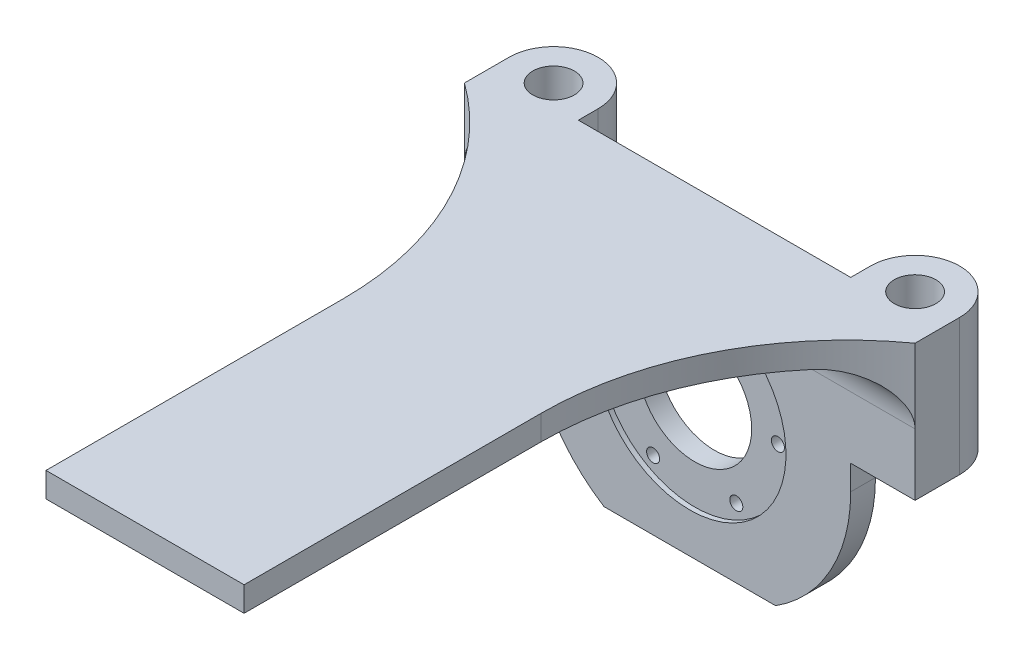
from build123d import *

# Parameters (mm, degrees)
SKETCH1_W                = 9
SKETCH1_H                = 55
SKETCH1_W_2              = 91
SKETCH1_H_2              = 5
BOSS_EXTRUDE3_DEPTH      = 5
SKETCH6_W                = 18
SKETCH6_H                = 60
BOSS_EXTRUDE4_DEPTH      = 18
SKETCH7_W                = 91
SKETCH7_H                = 5
BOSS_EXTRUDE5_DEPTH      = 100
SKETCH13_W               = 18
SKETCH13_H               = 5
CUT_EXTRUDE6_DEPTH       = 75
SKETCH16_R               = 4.2
CUT_EXTRUDE7_DEPTH       = 20
CUT_EXTRUDE8_DEPTH       = 75
CUT_EXTRUDE10_DEPTH      = 8
CUT_EXTRUDE11_DEPTH      = 22
CUT_EXTRUDE14_DEPTH      = 34
CUT_EXTRUDE14_DEPTH_BACK = 5
FILLET4_R                = 10
CUT_EXTRUDE15_DEPTH      = 24
CUT_EXTRUDE15_DEPTH_BACK = 1
SKETCH23_R               = 19.425
SKETCH24_R               = 1.315
CUT_EXTRUDE16_DEPTH      = 10
SKETCH26_W               = 40
SKETCH26_H               = 5
BOSS_EXTRUDE6_DEPTH      = 10


with BuildPart() as part:
    # Sketch1 → Boss-Extrude3 (new body)
    with BuildSketch(Plane.XY):
        with Locations((41, -0.737170899)):
            Rectangle(SKETCH1_W, SKETCH1_H)
        with Locations((32, -0.737170899)):
            Rectangle(SKETCH1_W, SKETCH1_H)
        with BuildLine():
            Line((27.5, 26.762829101), (0, 26.762829101))
            Line((0, 26.762829101), (0, 10.762829101))
            ThreePointArc((0, 10.762829101), (8.131727984, 7.394557085), (11.5, -0.737170899))
            ThreePointArc((11.5, -0.737170899), (8.131727984, -8.868898883), (0, -12.237170899))
            Line((0, -12.237170899), (0, -28.237170899))
            Line((0, -28.237170899), (27.5, -28.237170899))
            Line((27.5, -28.237170899), (27.5, 26.762829101))
        make_face()
        with BuildLine():
            Line((0, 10.762829101), (0, 26.762829101))
            Line((0, 26.762829101), (-27.5, 26.762829101))
            Line((-27.5, 26.762829101), (-27.5, -28.237170899))
            Line((-27.5, -28.237170899), (0, -28.237170899))
            Line((0, -28.237170899), (0, -12.237170899))
            ThreePointArc((0, -12.237170899), (-11.5, -0.737170899), (0, 10.762829101))
        make_face()
        with Locations((-32, -0.737170899)):
            Rectangle(SKETCH1_W, SKETCH1_H)
        with Locations((-41, -0.737170899)):
            Rectangle(SKETCH1_W, SKETCH1_H)
        with Locations((0, 29.262829101)):
            Rectangle(SKETCH1_W_2, SKETCH1_H_2)
    extrude(amount=BOSS_EXTRUDE3_DEPTH)

    # Sketch6 → Boss-Extrude4 (add)
    with BuildSketch(Plane(origin=(0, 0, 0), x_dir=(-1, 0, 0), z_dir=(0, 0, -1))):
        with Locations((-36.5, 1.762829101)):
            Rectangle(SKETCH6_W, SKETCH6_H)
        with Locations((36.5, 1.762829101)):
            Rectangle(SKETCH6_W, SKETCH6_H)
    extrude(amount=BOSS_EXTRUDE4_DEPTH)

    # Sketch7 → Boss-Extrude5 (add)
    with BuildSketch(Plane.XY.offset(5)):
        with Locations((0, 29.262829101)):
            Rectangle(SKETCH7_W, SKETCH7_H)
    extrude(amount=BOSS_EXTRUDE5_DEPTH)

    # Sketch13 → Cut-Extrude6 (cut)
    with BuildSketch(Plane(origin=(0, 31.762829101, 0), x_dir=(1, 0, 0), z_dir=(0, 1, 0))):
        with Locations((-36.5, 15.5)):
            Rectangle(SKETCH13_W, SKETCH13_H)
        with Locations((36.5, 15.5)):
            Rectangle(SKETCH13_W, SKETCH13_H)
    extrude(amount=-CUT_EXTRUDE6_DEPTH, mode=Mode.SUBTRACT)

    # Sketch16 → Cut-Extrude7 (cut)
    with BuildSketch(Plane(origin=(0, 31.762829101, 0), x_dir=(1, 0, 0), z_dir=(0, 1, 0))):
        with Locations(Location((-36.5, 4, 0), (0, 0, 180))):
            Circle(SKETCH16_R)
        with Locations(Location((36.5, 4, 0), (0, 0, 180))):
            Circle(SKETCH16_R)
    extrude(amount=-CUT_EXTRUDE7_DEPTH, mode=Mode.SUBTRACT)

    # Sketch17 → Cut-Extrude8 (cut)
    with BuildSketch(Plane(origin=(0, 31.762829101, 0), x_dir=(1, 0, 0), z_dir=(0, 1, 0))):
        with BuildLine():
            Line((-45.5, 13), (-45.5, 4))
            ThreePointArc((-45.5, 4), (-42.863961031, 10.363961031), (-36.5, 13))
            Line((-36.5, 13), (-45.5, 13))
        make_face()
        with BuildLine():
            ThreePointArc((-36.5, 13), (-30.136038969, 10.363961031), (-27.5, 4))
            Line((-27.5, 4), (-27.5, 13))
            Line((-27.5, 13), (-36.5, 13))
        make_face()
        with BuildLine():
            Line((27.5, 13), (27.5, 4))
            ThreePointArc((27.5, 4), (30.136038969, 10.363961031), (36.5, 13))
            Line((36.5, 13), (27.5, 13))
        make_face()
        with BuildLine():
            Line((45.5, 13), (36.5, 13))
            ThreePointArc((36.5, 13), (42.863961031, 10.363961031), (45.5, 4))
            Line((45.5, 4), (45.5, 13))
        make_face()
    extrude(amount=-CUT_EXTRUDE8_DEPTH, mode=Mode.SUBTRACT)

    # Sketch18 → Cut-Extrude10 (cut)
    with BuildSketch(Plane(origin=(0, 31.762829101, 0), x_dir=(1, 0, 0), z_dir=(0, 1, 0))):
        with BuildLine():
            ThreePointArc((-45.5, -105), (-26.743051045, -83.063543967), (-20, -55))
            Line((-20, -55), (-45.5, -55))
            Line((-45.5, -55), (-45.5, -105))
        make_face()
        with BuildLine():
            Line((-45.5, -55), (-20, -55))
            ThreePointArc((-20, -55), (-26.743051045, -26.936456033), (-45.5, -5))
            Line((-45.5, -5), (-45.5, -55))
        make_face()
        with BuildLine():
            ThreePointArc((-45.5, -105), (-26.743051045, -83.063543967), (-20, -55))
            Line((-20, -55), (-45.5, -55))
            Line((-45.5, -55), (-45.5, -105))
        make_face()
        with BuildLine():
            Line((-45.5, -55), (-20, -55))
            ThreePointArc((-20, -55), (-26.743051045, -26.936456033), (-45.5, -5))
            Line((-45.5, -5), (-45.5, -55))
        make_face()
        with BuildLine():
            Line((-20, -105), (-20, -55))
            ThreePointArc((-20, -55), (-26.743051045, -83.063543967), (-45.5, -105))
            Line((-45.5, -105), (-20, -105))
        make_face()
        with BuildLine():
            Line((20, -55), (20, -105))
            Line((20, -105), (45.5, -105))
            ThreePointArc((45.5, -105), (26.743051045, -83.063543967), (20, -55))
        make_face()
        with BuildLine():
            Line((45.5, -55), (45.5, -5))
            ThreePointArc((45.5, -5), (26.743051045, -26.936456033), (20, -55))
            Line((20, -55), (45.5, -55))
        make_face()
        with BuildLine():
            ThreePointArc((20, -55), (26.743051045, -83.063543967), (45.5, -105))
            Line((45.5, -105), (45.5, -55))
            Line((45.5, -55), (20, -55))
        make_face()
        with BuildLine():
            Line((45.5, -55), (45.5, -5))
            ThreePointArc((45.5, -5), (26.743051045, -26.936456033), (20, -55))
            Line((20, -55), (45.5, -55))
        make_face()
        with BuildLine():
            ThreePointArc((20, -55), (26.743051045, -83.063543967), (45.5, -105))
            Line((45.5, -105), (45.5, -55))
            Line((45.5, -55), (20, -55))
        make_face()
    extrude(amount=-CUT_EXTRUDE10_DEPTH, mode=Mode.SUBTRACT)

    # Sketch19 → Cut-Extrude11 (cut)
    with BuildSketch(Plane.XY.offset(5)):
        with BuildLine():
            Line((-32.5, -0.737170899), (-45.5, -0.737170899))
            Line((-45.5, -0.737170899), (-45.5, -28.237170899))
            Line((-45.5, -28.237170899), (-17.320508076, -28.237170899))
            ThreePointArc((-17.320508076, -28.237170899), (-28.453176558, -16.442798673), (-32.5, -0.737170899))
        make_face()
        with BuildLine():
            Line((45.5, -28.237170899), (17.320508076, -28.237170899))
            ThreePointArc((17.320508076, -28.237170899), (28.453176558, -16.442798673), (32.5, -0.737170899))
            Line((32.5, -0.737170899), (45.5, -0.737170899))
            Line((45.5, -0.737170899), (45.5, -28.237170899))
        make_face()
    extrude(amount=-CUT_EXTRUDE11_DEPTH, mode=Mode.SUBTRACT)

    # Sketch21 → Cut-Extrude14 (cut, two sides: drawn at the far end of the back side and taken through both)
    with BuildSketch(Plane.XZ.offset(0.737170899).offset(-CUT_EXTRUDE14_DEPTH_BACK)):
        with BuildLine():
            Line((27.5, 0), (32.5, 0))
            Line((32.5, 0), (32.5, 5))
            Line((32.5, 5), (45.5, 5))
            Line((45.5, 5), (45.5, -4))
            ThreePointArc((45.5, -4), (36.5, -13), (27.5, -4))
            Line((27.5, -4), (27.5, 0))
        make_face()
        with BuildLine():
            Line((-27.5, -4), (-27.5, 0))
            Line((-27.5, 0), (-32.5, 0))
            Line((-32.5, 0), (-32.5, 5))
            Line((-32.5, 5), (-45.5, 5))
            Line((-45.5, 5), (-45.5, -4))
            ThreePointArc((-45.5, -4), (-36.5, -13), (-27.5, -4))
        make_face()
    extrude(amount=CUT_EXTRUDE14_DEPTH + CUT_EXTRUDE14_DEPTH_BACK, mode=Mode.SUBTRACT)

    # Fillet4
    # the kernel refuses this fillet: 10 mm, written as the material it adds along each edge
    with BuildSketch(Plane(origin=(70.5, 26.762829101, 5), x_dir=(0, -1, 0), z_dir=(-1, 0, 0))) as fillet4_piece_1_section:
        with BuildLine():
            CenterArc((FILLET4_R, FILLET4_R), FILLET4_R, 180, 90)
            Line((0, FILLET4_R), (0, 0))
            Line((0, 0), (FILLET4_R, 0))
        make_face()
    fillet4_piece_1 = extrude(amount=141, mode=Mode.PRIVATE)
    fillet4_piece_1 = fillet4_piece_1 - Plane(origin=(-81.769607843, 24.471447362, 55), x_dir=(0.5871756209824568, 0, 0.8094595667010591), z_dir=(0, 1, 0)) * Cylinder(61.769607843, 322, mode=Mode.PRIVATE)
    fillet4_piece_1 = fillet4_piece_1 - Plane(origin=(81.769607843, 24.471447362, 55), x_dir=(-0.5871756209824566, 0, -0.8094595667010592), z_dir=(0, 1, 0)) * Cylinder(61.769607843, 322, mode=Mode.PRIVATE)
    add(fillet4_piece_1)

    # Sketch23 → Cut-Extrude15 (cut, two sides: drawn at the far end of the back side and taken through both)
    with BuildSketch(Plane.XY.offset(5).offset(-CUT_EXTRUDE15_DEPTH_BACK)):
        with Locations(Location((0, -0.737170899, 0), (0, 0, 115.723259522))):
            Circle(SKETCH23_R)
    extrude(amount=CUT_EXTRUDE15_DEPTH + CUT_EXTRUDE15_DEPTH_BACK, mode=Mode.SUBTRACT)

    # Sketch24 → Cut-Extrude16 (cut)
    with BuildSketch(Plane.XY.offset(4)):
        with Locations((-8.4, 13.812055885)):
            Circle(SKETCH24_R)
        with Locations((8.4, -15.286397682)):
            Circle(SKETCH24_R)
        with Locations((-8.4, -15.286397682)):
            Circle(SKETCH24_R)
        with Locations((16.8, -0.737170899)):
            Circle(SKETCH24_R)
        with Locations((-16.8, -0.737170899)):
            Circle(SKETCH24_R)
        with Locations((8.4, 13.812055885)):
            Circle(SKETCH24_R)
    extrude(amount=-CUT_EXTRUDE16_DEPTH, mode=Mode.SUBTRACT)

    # Sketch26 → Boss-Extrude6 (add)
    with BuildSketch(Plane.XY.offset(105)):
        with Locations((0, 29.262829101)):
            Rectangle(SKETCH26_W, SKETCH26_H)
    extrude(amount=BOSS_EXTRUDE6_DEPTH)


solid = part.part
